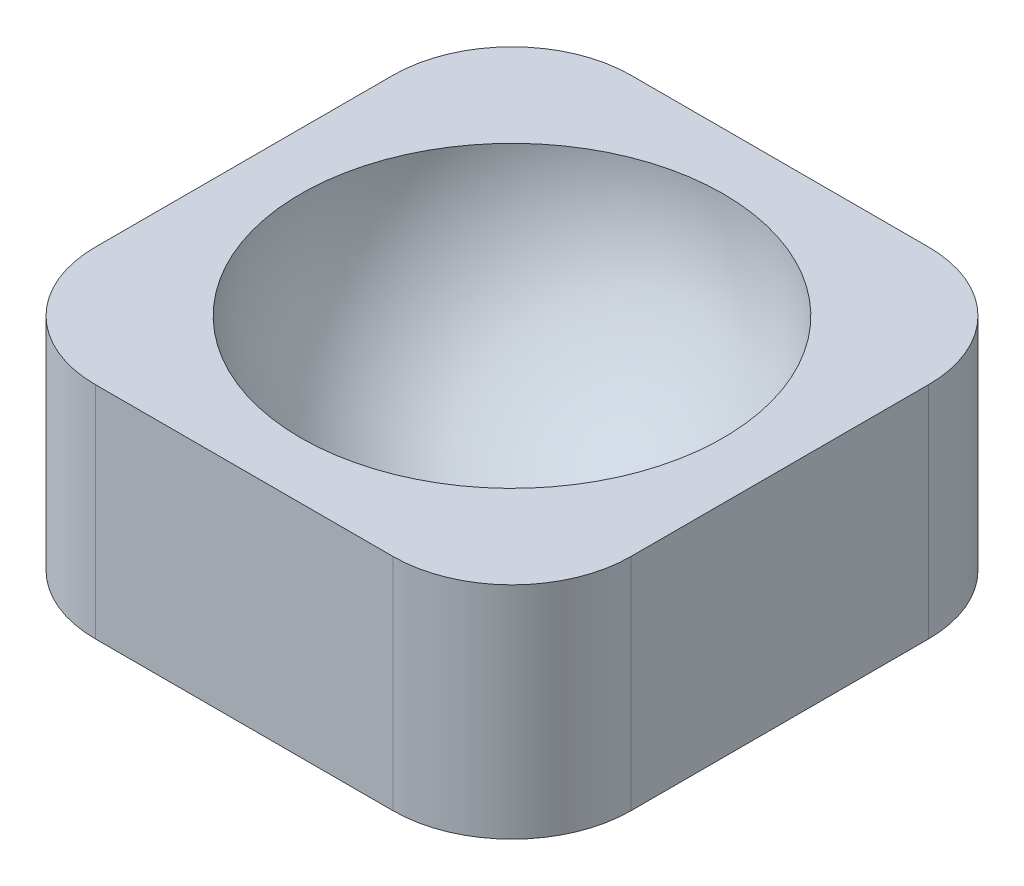
from build123d import *

# Parameters (mm, degrees)
SKETCH1_W           = 114.3
SKETCH1_H           = 114.3
BOSS_EXTRUDE1_DEPTH = 46.99
CUT_REVOLVE1_ANGLE  = 180
FILLET1_R           = 25.4


with BuildPart() as part:
    # Sketch1 → Boss-Extrude1 (new body)
    with BuildSketch(Plane(origin=(0, 0, 0), x_dir=(1, 0, 0), z_dir=(0, 1, 0))):
        with Locations((-57.15, 57.15)):
            Rectangle(SKETCH1_W, SKETCH1_H)
    extrude(amount=BOSS_EXTRUDE1_DEPTH)

    # Sketch2 → Cut-Revolve1 (revolve, cut)
    with BuildSketch(Plane(origin=(0, 46.99, 0), x_dir=(1, 0, 0), z_dir=(0, 1, 0))):
        with BuildLine():
            ThreePointArc((-12.065, 57.15), (-25.27009077, 89.02990923), (-57.15, 102.235))
            Line((-57.15, 102.235), (-57.15, 12.065))
            ThreePointArc((-57.15, 12.065), (-25.27009077, 25.27009077), (-12.065, 57.15))
        make_face()
    revolve(axis=Axis((-57.15, 46.99, -114.3), (0, 0, -1)), revolution_arc=CUT_REVOLVE1_ANGLE, mode=Mode.SUBTRACT)

    # Fillet1
    fillet1_edges = [part.edges().sort_by_distance(p)[0] for p in [
        (0, 23.495, 0),
        (-114.3, 23.495, 0),
        (-114.3, 23.495, -114.3),
        (0, 23.495, -114.3),
    ]]
    fillet(fillet1_edges, radius=FILLET1_R)


solid = part.part
